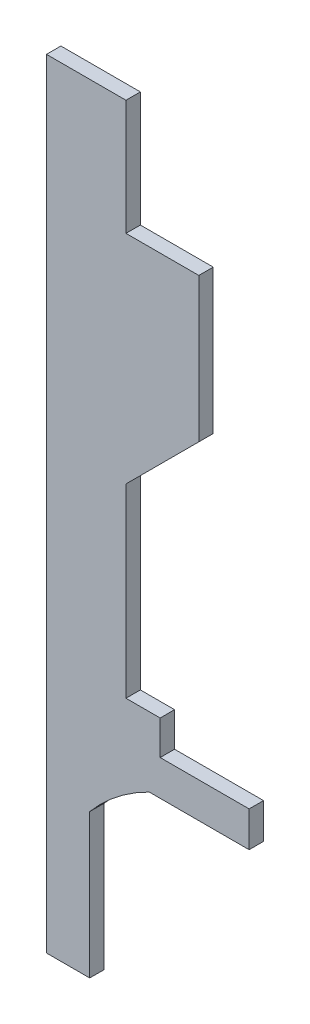
from build123d import *

# Parameters (mm, degrees)
BOSS_EXTRU_1_DEPTH = 5


with BuildPart() as part:
    # Esquisse1 → Boss.-Extru.1 (new body)
    with BuildSketch(Plane.XY):
        with BuildLine():
            Line((70.297192809, 66.186397284), (70.297192809, 78.451204868))
            Line((70.297192809, 78.451204868), (39.439293445, 78.451204868))
            Line((39.439293445, 78.451204868), (39.439293445, 90.333987182))
            Line((39.439293445, 90.333987182), (27.572537656, 90.333987182))
            Line((27.572537656, 90.333987182), (27.572537656, 154.717501023))
            Line((27.572537656, 154.717501023), (52.855036633, 180))
            Line((52.855036633, 180), (52.855036633, 230))
            Line((52.855036633, 230), (27.572537656, 230))
            Line((27.572537656, 230), (27.572537656, 270))
            Line((27.572537656, 270), (0, 270))
            Line((0, 270), (0, 0))
            Line((0, 0), (15, 0))
            Line((15, 0), (15, 50))
            ThreePointArc((15, 50), (24.488558001, 59.174106779), (35.670004688, 66.186397284))
            Line((35.670004688, 66.186397284), (70.297192809, 66.186397284))
        make_face()
    extrude(amount=BOSS_EXTRU_1_DEPTH)


solid = part.part
